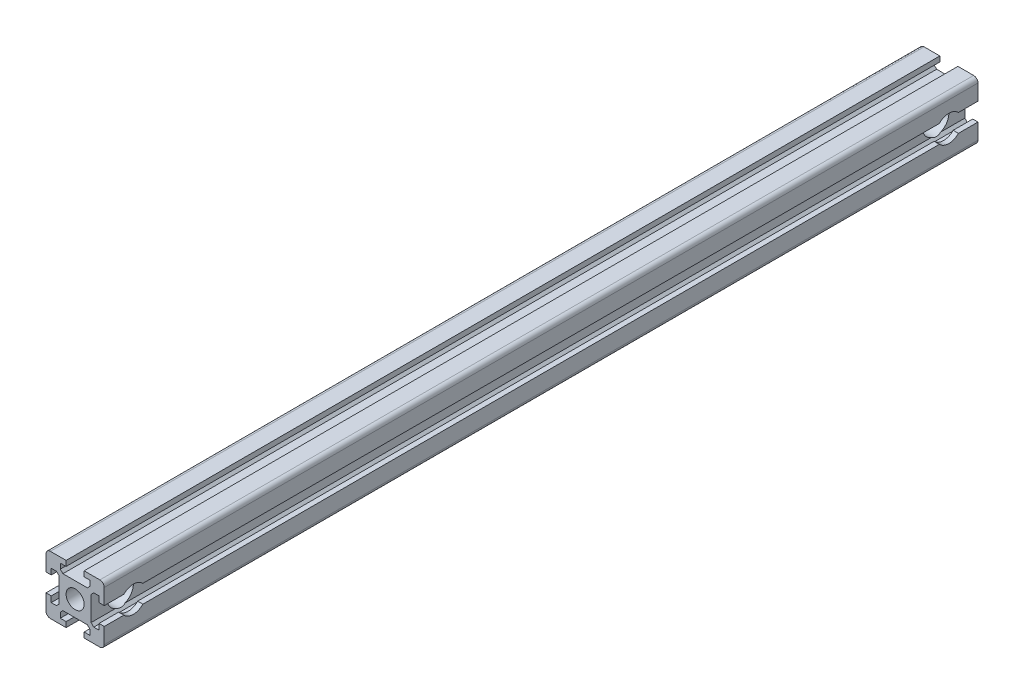
from build123d import *

# Parameters (mm, degrees)
SKETCH1_R               = 3.1
BOSS_EXTRUDE1_DEPTH     = 300
CUT_EXTRUDE2_DEPTH      = 301.566181919
CUT_EXTRUDE2_DEPTH_BACK = 11
SKETCH3_R               = 4.5


with BuildPart() as part:
    # Sketch1 → Boss-Extrude1 (new body)
    with BuildSketch(Plane.XY):
        with BuildLine():
            Line((-10, 3.1), (-8.2, 3.1))
            Line((-8.2, 3.1), (-8.2, 5.1))
            Line((-8.2, 5.1), (-6.4, 5.1))
            Line((-6.4, 5.1), (-5.492892349, 4.192892349))
            Line((-5.492892349, 4.192892349), (-5.492892349, -4.192892349))
            Line((-5.492892349, -4.192892349), (-6.4, -5.1))
            Line((-6.4, -5.1), (-8.2, -5.1))
            Line((-8.2, -5.1), (-8.2, -3.1))
            Line((-8.2, -3.1), (-10, -3.1))
            Line((-10, -3.1), (-10, -8.5))
            ThreePointArc((-10, -8.5), (-9.560660172, -9.560660172), (-8.5, -10))
            Line((-8.5, -10), (-3.1, -10))
            Line((-3.1, -10), (-3.1, -8.2))
            Line((-3.1, -8.2), (-5.1, -8.2))
            Line((-5.1, -8.2), (-5.1, -6.4))
            Line((-5.1, -6.4), (-4.192892349, -5.492892349))
            Line((-4.192892349, -5.492892349), (4.192892349, -5.492892349))
            Line((4.192892349, -5.492892349), (5.1, -6.4))
            Line((5.1, -6.4), (5.1, -8.2))
            Line((5.1, -8.2), (3.1, -8.2))
            Line((3.1, -8.2), (3.1, -10))
            Line((3.1, -10), (8.5, -10))
            ThreePointArc((8.5, -10), (9.560660172, -9.560660172), (10, -8.5))
            Line((10, -8.5), (10, -3.1))
            Line((10, -3.1), (8.2, -3.1))
            Line((8.2, -3.1), (8.2, -5.1))
            Line((8.2, -5.1), (6.4, -5.1))
            Line((6.4, -5.1), (5.492892349, -4.192892349))
            Line((5.492892349, -4.192892349), (5.492892349, 4.192892349))
            Line((5.492892349, 4.192892349), (6.4, 5.1))
            Line((6.4, 5.1), (8.2, 5.1))
            Line((8.2, 5.1), (8.2, 3.1))
            Line((8.2, 3.1), (10, 3.1))
            Line((10, 3.1), (10, 8.5))
            ThreePointArc((10, 8.5), (9.560660172, 9.560660172), (8.5, 10))
            Line((8.5, 10), (3.1, 10))
            Line((3.1, 10), (3.1, 8.2))
            Line((3.1, 8.2), (5.1, 8.2))
            Line((5.1, 8.2), (5.1, 6.4))
            Line((5.1, 6.4), (4.192892349, 5.492892349))
            Line((4.192892349, 5.492892349), (-4.192892349, 5.492892349))
            Line((-4.192892349, 5.492892349), (-5.1, 6.4))
            Line((-5.1, 6.4), (-5.1, 8.2))
            Line((-5.1, 8.2), (-3.1, 8.2))
            Line((-3.1, 8.2), (-3.1, 10))
            Line((-3.1, 10), (-8.5, 10))
            ThreePointArc((-8.5, 10), (-9.560660172, 9.560660172), (-10, 8.5))
            Line((-10, 8.5), (-10, 3.1))
        make_face()
        Circle(SKETCH1_R, mode=Mode.SUBTRACT)
    extrude(amount=BOSS_EXTRUDE1_DEPTH)

    # Sketch3 → Cut-Extrude2 (cut, two sides: drawn at the far end of the back side and taken through both)
    with BuildSketch(Plane(origin=(5.492892349, 0, 0), x_dir=(0, 0, -1), z_dir=(1, 0, 0)).offset(-CUT_EXTRUDE2_DEPTH_BACK)):
        with Locations((-10, 0)):
            Circle(SKETCH3_R)
        with Locations((-290, 0)):
            Circle(SKETCH3_R)
    extrude(amount=CUT_EXTRUDE2_DEPTH + CUT_EXTRUDE2_DEPTH_BACK, mode=Mode.SUBTRACT)


solid = part.part
